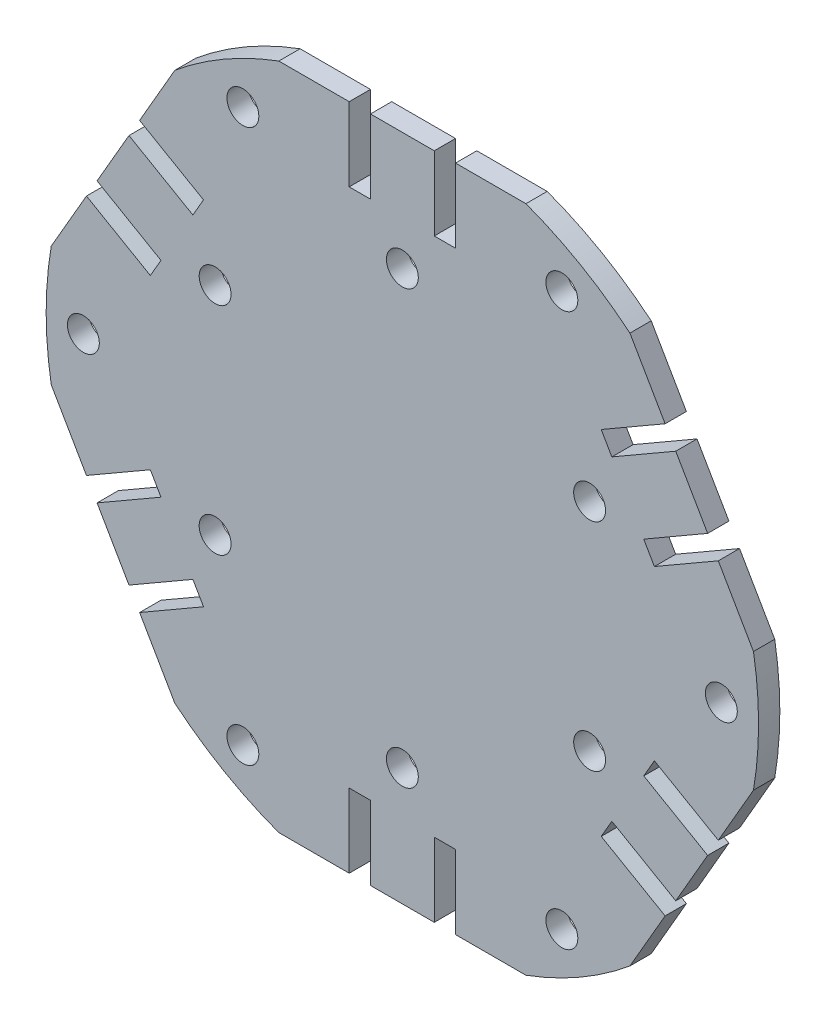
from build123d import *

# Parameters (mm, degrees)
MODEL_R             = 1.5
BOSS_EXTRUDE1_DEPTH = 2


with BuildPart() as part:
    # Model → Boss-Extrude1 (new body)
    with BuildSketch(Plane.XY):
        with BuildLine():
            Line((-19.701410202, -14.838716098), (-18.701410202, -16.570766906))
            Line((-18.701410202, -16.570766906), (-24.711054778, -20.04043682))
            Line((-24.711054778, -20.04043682), (-21.401694577, -25.77241683))
            ThreePointArc((-21.401694577, -25.77241683), (-16.75, -29.011851027), (-11.618720403, -31.420619602))
            Line((-11.618720403, -31.420619602), (-5, -31.420619602))
            Line((-5, -31.420619602), (-5, -24.481279774))
            Line((-5, -24.481279774), (-3, -24.481279774))
            Line((-3, -24.481279774), (-3, -31.420619602))
            Line((-3, -31.420619602), (3, -31.420619602))
            Line((3, -31.420619602), (3, -24.481279774))
            Line((3, -24.481279774), (5, -24.481279774))
            Line((5, -24.481279774), (5, -31.420619602))
            Line((5, -31.420619602), (11.618720403, -31.420619602))
            ThreePointArc((11.618720403, -31.420619602), (16.75, -29.011851027), (21.401694577, -25.77241683))
            Line((21.401694577, -25.77241683), (24.711054778, -20.04043682))
            Line((24.711054778, -20.04043682), (18.701410202, -16.570766906))
            Line((18.701410202, -16.570766906), (19.701410202, -14.838716098))
            Line((19.701410202, -14.838716098), (25.711054778, -18.308386013))
            Line((25.711054778, -18.308386013), (28.711054778, -13.11223359))
            Line((28.711054778, -13.11223359), (22.701410202, -9.642563676))
            Line((22.701410202, -9.642563676), (23.701410202, -7.910512868))
            Line((23.701410202, -7.910512868), (29.711054778, -11.380182782))
            Line((29.711054778, -11.380182782), (33.02041498, -5.648202773))
            ThreePointArc((33.02041498, -5.648202773), (33.5, 0), (33.02041498, 5.648202773))
            Line((33.02041498, 5.648202773), (29.711054778, 11.380182782))
            Line((29.711054778, 11.380182782), (23.701410202, 7.910512868))
            Line((23.701410202, 7.910512868), (22.701410202, 9.642563676))
            Line((22.701410202, 9.642563676), (28.711054778, 13.11223359))
            Line((28.711054778, 13.11223359), (25.711054778, 18.308386013))
            Line((25.711054778, 18.308386013), (19.701410202, 14.838716098))
            Line((19.701410202, 14.838716098), (18.701410202, 16.570766906))
            Line((18.701410202, 16.570766906), (24.711054778, 20.04043682))
            Line((24.711054778, 20.04043682), (21.401694577, 25.77241683))
            ThreePointArc((21.401694577, 25.77241683), (16.75, 29.011851027), (11.618720403, 31.420619602))
            Line((11.618720403, 31.420619602), (5, 31.420619602))
            Line((5, 31.420619602), (5, 24.481279774))
            Line((5, 24.481279774), (3, 24.481279774))
            Line((3, 24.481279774), (3, 31.420619602))
            Line((3, 31.420619602), (-3, 31.420619602))
            Line((-3, 31.420619602), (-3, 24.481279774))
            Line((-3, 24.481279774), (-5, 24.481279774))
            Line((-5, 24.481279774), (-5, 31.420619602))
            Line((-5, 31.420619602), (-11.618720403, 31.420619602))
            ThreePointArc((-11.618720403, 31.420619602), (-16.75, 29.011851027), (-21.401694577, 25.77241683))
            Line((-21.401694577, 25.77241683), (-24.711054778, 20.04043682))
            Line((-24.711054778, 20.04043682), (-18.701410202, 16.570766906))
            Line((-18.701410202, 16.570766906), (-19.701410202, 14.838716098))
            Line((-19.701410202, 14.838716098), (-25.711054778, 18.308386013))
            Line((-25.711054778, 18.308386013), (-28.711054778, 13.11223359))
            Line((-28.711054778, 13.11223359), (-22.701410202, 9.642563676))
            Line((-22.701410202, 9.642563676), (-23.701410202, 7.910512868))
            Line((-23.701410202, 7.910512868), (-29.711054778, 11.380182782))
            Line((-29.711054778, 11.380182782), (-33.02041498, 5.648202773))
            ThreePointArc((-33.02041498, 5.648202773), (-33.5, 0), (-33.02041498, -5.648202773))
            Line((-33.02041498, -5.648202773), (-29.711054778, -11.380182782))
            Line((-29.711054778, -11.380182782), (-23.701410202, -7.910512868))
            Line((-23.701410202, -7.910512868), (-22.701410202, -9.642563676))
            Line((-22.701410202, -9.642563676), (-28.711054778, -13.11223359))
            Line((-28.711054778, -13.11223359), (-25.711054778, -18.308386013))
            Line((-25.711054778, -18.308386013), (-19.701410202, -14.838716098))
        make_face()
        with Locations((-15, -25.980762114)):
            Circle(MODEL_R, mode=Mode.SUBTRACT)
        with Locations((-17.610482102, -10.167416582)):
            Circle(MODEL_R, mode=Mode.SUBTRACT)
        with Locations((15, -25.980762114)):
            Circle(MODEL_R, mode=Mode.SUBTRACT)
        with Locations((0, -20.334833165)):
            Circle(MODEL_R, mode=Mode.SUBTRACT)
        with Locations((17.610482102, -10.167416582)):
            Circle(MODEL_R, mode=Mode.SUBTRACT)
        with Locations((-30, 0)):
            Circle(MODEL_R, mode=Mode.SUBTRACT)
        with Locations((-17.610482102, 10.167416582)):
            Circle(MODEL_R, mode=Mode.SUBTRACT)
        with Locations((-15, 25.980762114)):
            Circle(MODEL_R, mode=Mode.SUBTRACT)
        with Locations((30, 0)):
            Circle(MODEL_R, mode=Mode.SUBTRACT)
        with Locations((17.610482102, 10.167416582)):
            Circle(MODEL_R, mode=Mode.SUBTRACT)
        with Locations((0, 20.334833165)):
            Circle(MODEL_R, mode=Mode.SUBTRACT)
        with Locations((15, 25.980762114)):
            Circle(MODEL_R, mode=Mode.SUBTRACT)
    extrude(amount=BOSS_EXTRUDE1_DEPTH)


solid = part.part
